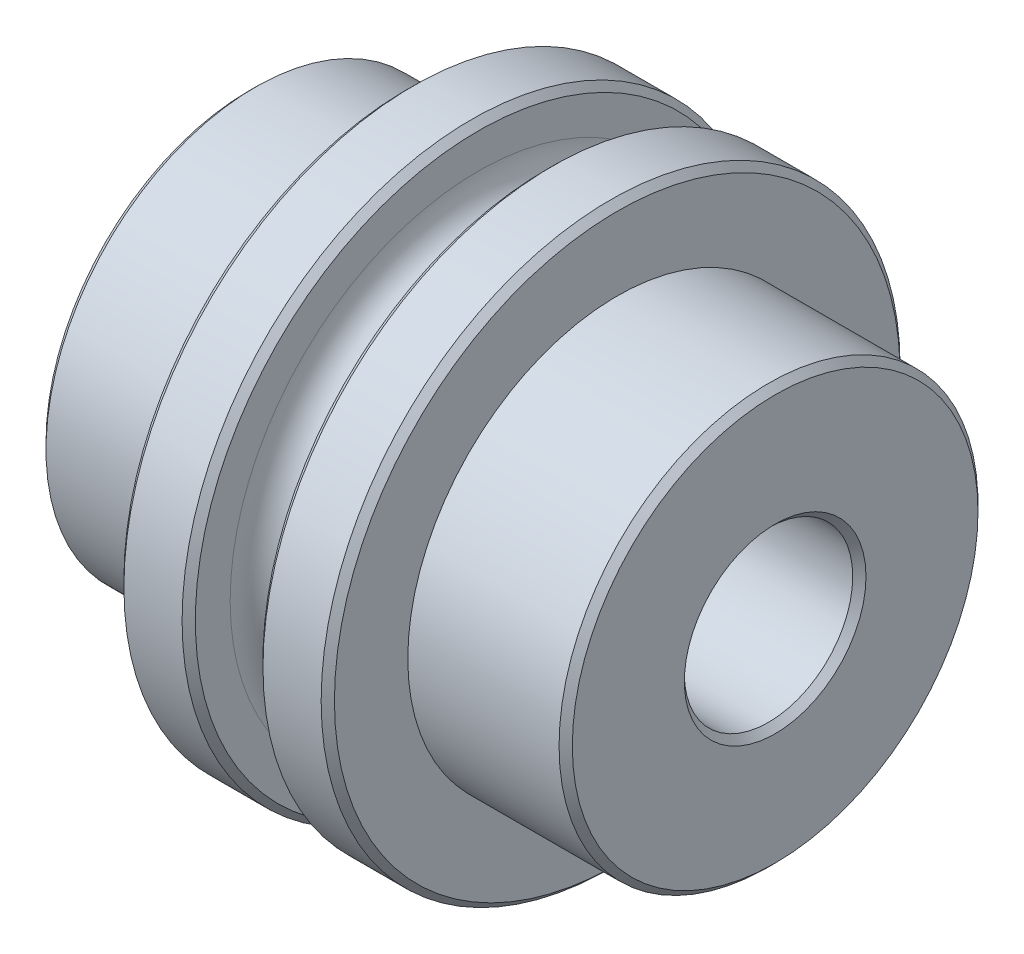
from build123d import *

# Parameters (mm, degrees)
SKETCH1_R           = 12.6365
BOSS_EXTRUDE1_DEPTH = 9.525
SKETCH2_R           = 17.4625
BOSS_EXTRUDE2_DEPTH = 12.7
SKETCH5_R           = 5.08
CUT_EXTRUDE3_DEPTH  = 41.223628783
CHAMFER1_SIZE       = 0.4


with BuildPart() as part:
    # Sketch1 → Boss-Extrude1 (new body)
    with BuildSketch(Plane(origin=(0, 0, 0), x_dir=(0, 0, -1), z_dir=(1, 0, 0))):
        Circle(SKETCH1_R)
    boss_extrude1 = extrude(amount=BOSS_EXTRUDE1_DEPTH)

    # Sketch2 → Boss-Extrude2 (add)
    with BuildSketch(Plane.ZY):
        Circle(SKETCH2_R)
    extrude(amount=BOSS_EXTRUDE2_DEPTH)

    # Sketch6 → Cut-Revolve1 (revolve, cut)
    with BuildSketch(Plane.XY):
        with BuildLine():
            Line((-4.310000016, 17.4625), (-8.389999984, 17.4625))
            Line((-8.389999984, 17.4625), (-8.389999984, 14.96249992))
            ThreePointArc((-8.389999984, 14.96249992), (-6.35, 12.922499936), (-4.310000016, 14.96249992))
            Line((-4.310000016, 14.96249992), (-4.310000016, 17.4625))
        make_face()
    revolve(axis=Axis((-6.35, 0, 0), (1, 0, 0)), mode=Mode.SUBTRACT)

    # Mirror1: Boss-Extrude1 across plane
    add(boss_extrude1.mirror(Plane.ZY.offset(6.35)))

    # Sketch5 → Cut-Extrude3 (cut, through all)
    with BuildSketch(Plane.ZY.offset(22.225)):
        Circle(SKETCH5_R)
    extrude(amount=-CUT_EXTRUDE3_DEPTH, mode=Mode.SUBTRACT)

    # Chamfer1
    chamfer1_edges = [part.edges().sort_by_distance(p)[0] for p in [
        (9.525, 0, 12.6365),
        (9.525, 0, -5.08),
        (-12.7, 0, -17.4625),
        (-8.389999984, 0, -17.4625),
        (0, 0, -17.4625),
        (-4.310000016, 0, -17.4625),
        (-22.225, 0, 12.6365),
        (-22.225, 0, -5.08),
    ]]
    chamfer(chamfer1_edges, length=CHAMFER1_SIZE)


solid = part.part
